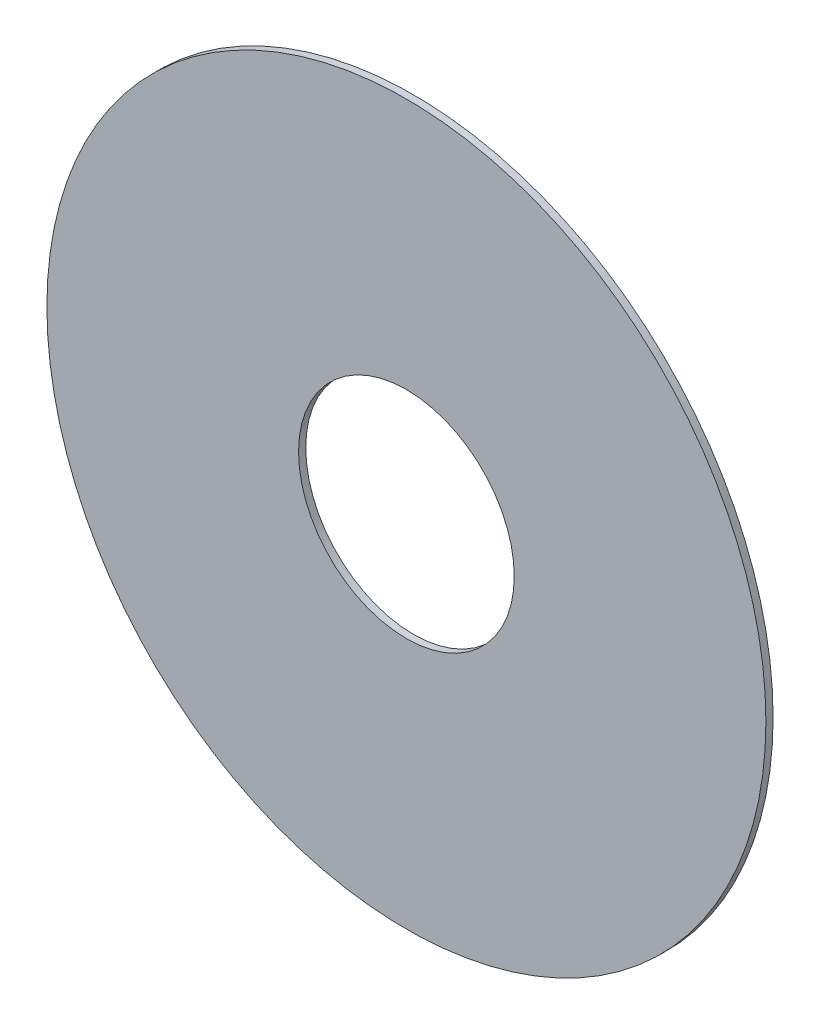
from build123d import *

# Parameters (mm, degrees)
SKETCH1_R          = 100
SKETCH1_R_2        = 30
BASE_FLANGE1_DEPTH = 2


# Sheet-metal steps are written as plain solids
with BuildPart() as part:
    # Sketch1 → Base-Flange1 (new body)
    with BuildSketch(Plane.XY):
        Circle(SKETCH1_R)
        Circle(SKETCH1_R_2, mode=Mode.SUBTRACT)
    extrude(amount=-BASE_FLANGE1_DEPTH)


solid = part.part
